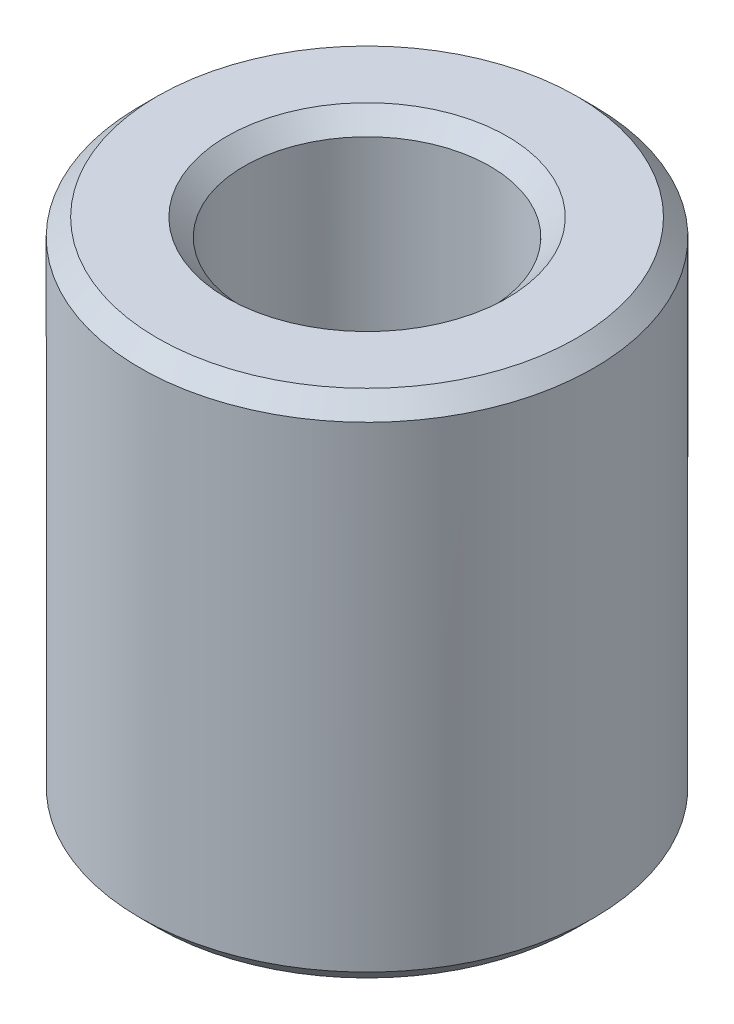
from build123d import *

# Parameters (mm, degrees)
SKETCH1_R           = 12.5
BOSS_EXTRUDE1_DEPTH = 28.136745543
SKETCH2_R           = 6.770858717
CUT_EXTRUDE1_DEPTH  = 34.229150602
CHAMFER1_SIZE       = 0.95144388


with BuildPart() as part:
    # Sketch1 → Boss-Extrude1 (new body)
    with BuildSketch(Plane(origin=(0, 0, 0), x_dir=(1, 0, 0), z_dir=(0, 1, 0))):
        Circle(SKETCH1_R)
    extrude(amount=BOSS_EXTRUDE1_DEPTH)

    # Sketch2 → Cut-Extrude1 (cut, through all)
    with BuildSketch(Plane(origin=(0, 0, 0), x_dir=(1, 0, 0), z_dir=(0, 1, 0))):
        Circle(SKETCH2_R)
    extrude(amount=CUT_EXTRUDE1_DEPTH, mode=Mode.SUBTRACT)

    # Chamfer1
    chamfer1_edges = [part.edges().sort_by_distance(p)[0] for p in [
        (-6.770858717, 28.136745543, 0),
        (-6.770858717, 0, 0),
        (-12.5, 0, 0),
        (-12.5, 28.136745543, 0),
    ]]
    chamfer(chamfer1_edges, length=CHAMFER1_SIZE)


solid = part.part
